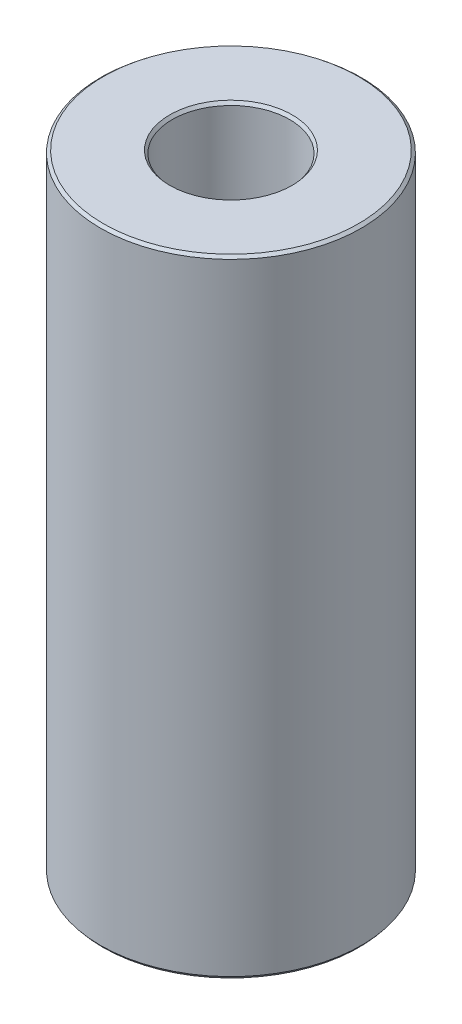
from build123d import *
from OCP.BRepFilletAPI import BRepFilletAPI_MakeChamfer

# Parameters (mm, degrees)
SKETCH1_R           = 35
BOSS_EXTRUDE1_DEPTH = 168.064445703
SKETCH2_R           = 15.773005348
CUT_EXTRUDE1_DEPTH  = 176.201763431
CHAMFER1_SIZE       = 0.643950777
CHAMFER1_SIZE2      = 0.782957547


with BuildPart() as part:
    # Sketch1 → Boss-Extrude1 (new body)
    with BuildSketch(Plane(origin=(0, 0, 0), x_dir=(1, 0, 0), z_dir=(0, 1, 0))):
        Circle(SKETCH1_R)
    extrude(amount=BOSS_EXTRUDE1_DEPTH)

    # Sketch2 → Cut-Extrude1 (cut, through all)
    with BuildSketch(Plane(origin=(0, 0, 0), x_dir=(1, 0, 0), z_dir=(0, 1, 0))):
        Circle(SKETCH2_R)
    extrude(amount=CUT_EXTRUDE1_DEPTH, mode=Mode.SUBTRACT)

    # Chamfer1: one chamfer whose edges measure the first distance from different faces: ONE call of the kernel's chamfer builder (chamfer() names one face for all edges)
    chamfer1_edges_1 = [part.edges().sort_by_distance(p)[0] for p in [
        (-15.773005348, 168.064445703, 0),
    ]]
    chamfer1_side_1 = [part.faces().sort_by_distance(p)[0] for p in [
        (-34.010050506, 168.064445703, 0),
    ]]
    chamfer1_edges_2 = [part.edges().sort_by_distance(p)[0] for p in [
        (-15.773005348, 0, 0),
    ]]
    chamfer1_side_2 = [part.faces().sort_by_distance(p)[0] for p in [
        (-15.773005348, 84.032222851, 0),
    ]]
    chamfer1_edges_3 = [part.edges().sort_by_distance(p)[0] for p in [
        (-35, 0, 0),
    ]]
    chamfer1_side_3 = [part.faces().sort_by_distance(p)[0] for p in [
        (-34.010050506, 0, 0),
    ]]
    chamfer1_edges_4 = [part.edges().sort_by_distance(p)[0] for p in [
        (-35, 168.064445703, 0),
    ]]
    chamfer1_side_4 = [part.faces().sort_by_distance(p)[0] for p in [
        (-35, 84.032222851, 0),
    ]]
    chamfer1 = BRepFilletAPI_MakeChamfer(part.part.solid().wrapped)
    for e in chamfer1_edges_1:
        chamfer1.Add(CHAMFER1_SIZE, CHAMFER1_SIZE2, e.wrapped, chamfer1_side_1[0].wrapped)  # the first distance lies on this face
    for e in chamfer1_edges_2:
        chamfer1.Add(CHAMFER1_SIZE, CHAMFER1_SIZE2, e.wrapped, chamfer1_side_2[0].wrapped)  # the first distance lies on this face
    for e in chamfer1_edges_3:
        chamfer1.Add(CHAMFER1_SIZE, CHAMFER1_SIZE2, e.wrapped, chamfer1_side_3[0].wrapped)  # the first distance lies on this face
    for e in chamfer1_edges_4:
        chamfer1.Add(CHAMFER1_SIZE, CHAMFER1_SIZE2, e.wrapped, chamfer1_side_4[0].wrapped)  # the first distance lies on this face
    add(Compound.cast(chamfer1.Shape()), mode=Mode.REPLACE)


solid = part.part
